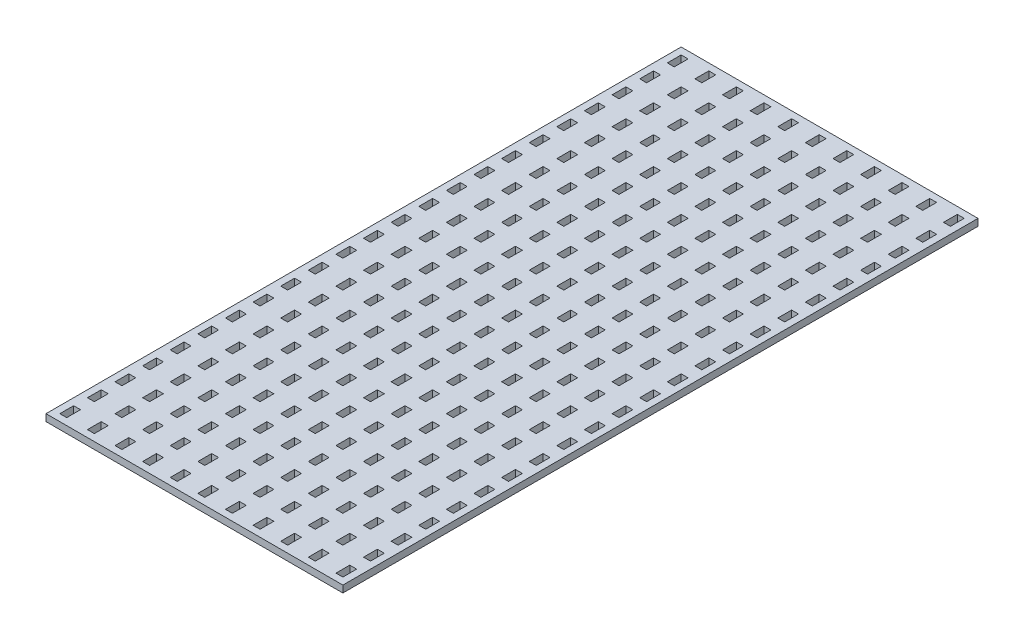
from build123d import *

# Parameters (mm, degrees)
SKETCH1_W              = 273.05
SKETCH1_H              = 584.2
BOSS_EXTRUDE1_DEPTH    = 3.175
SKETCH2_W              = 6.35
SKETCH2_H              = 12.7
CUT_EXTRUDE1_DEPTH     = 323.493113299
LPATTERN1_COUNT        = 7
LPATTERN1_PITCH        = 25.4
LPATTERN1_COUNT_DIR2   = 7
LPATTERN1_PITCH_DIR2   = 25.4
LPATTERN2_START        = -130.175
LPATTERN2_OUTLINE_W    = 6.35
LPATTERN2_OUTLINE_H    = 12.7
LPATTERN2_DEPTH        = 6.35
LPATTERN2_START_2      = -104.775
LPATTERN2_2_OUTLINE_W  = 6.35
LPATTERN2_2_OUTLINE_H  = 12.7
LPATTERN2_2_DEPTH      = 6.35
LPATTERN2_START_3      = -79.375
LPATTERN2_3_OUTLINE_W  = 6.35
LPATTERN2_3_OUTLINE_H  = 12.7
LPATTERN2_3_DEPTH      = 6.35
LPATTERN2_START_4      = -53.975
LPATTERN2_4_OUTLINE_W  = 6.35
LPATTERN2_4_OUTLINE_H  = 12.7
LPATTERN2_4_DEPTH      = 6.35
LPATTERN2_START_5      = -28.575
LPATTERN2_5_OUTLINE_W  = 6.35
LPATTERN2_5_OUTLINE_H  = 12.7
LPATTERN2_5_DEPTH      = 6.35
LPATTERN2_START_6      = -3.175
LPATTERN2_6_OUTLINE_W  = 6.35
LPATTERN2_6_OUTLINE_H  = 12.7
LPATTERN2_6_DEPTH      = 6.35
LPATTERN2_START_7      = 22.225
LPATTERN2_7_OUTLINE_W  = 6.35
LPATTERN2_7_OUTLINE_H  = 12.7
LPATTERN2_7_DEPTH      = 6.35
LPATTERN2_START_8      = 47.625
LPATTERN2_8_OUTLINE_W  = 6.35
LPATTERN2_8_OUTLINE_H  = 12.7
LPATTERN2_8_DEPTH      = 6.35
LPATTERN2_START_9      = 73.025
LPATTERN2_9_OUTLINE_W  = 6.35
LPATTERN2_9_OUTLINE_H  = 12.7
LPATTERN2_9_DEPTH      = 6.35
LPATTERN2_START_10     = 98.425
LPATTERN2_10_OUTLINE_W = 6.35
LPATTERN2_10_OUTLINE_H = 12.7
LPATTERN2_10_DEPTH     = 6.35
LPATTERN2_START_11     = 123.825
LPATTERN2_11_OUTLINE_W = 6.35
LPATTERN2_11_OUTLINE_H = 12.7
LPATTERN2_11_DEPTH     = 6.35


# Read off the part's stored shape, not the designer's step: LPattern2
with BuildPart() as part:
    # Sketch1 → Boss-Extrude1 (new, symmetric)
    with BuildSketch(Plane(origin=(0, 0, 0), x_dir=(1, 0, 0), z_dir=(0, 1, 0))):
        Rectangle(SKETCH1_W, SKETCH1_H)
    extrude(amount=BOSS_EXTRUDE1_DEPTH, both=True)

    # Sketch2 → Cut-Extrude1 (cut, through all)
    with BuildSketch(Plane(origin=(0, 3.175, 0), x_dir=(1, 0, 0), z_dir=(0, 1, 0))):
        Rectangle(SKETCH2_W, SKETCH2_H)
    cut_extrude1 = extrude(amount=-CUT_EXTRUDE1_DEPTH, mode=Mode.SUBTRACT)

    # LPattern1: Cut-Extrude1 7 × 7
    with Locations(*[Vector(1, 0, 0) * (i * LPATTERN1_PITCH) + Vector(-1, 0, 0) * (j * LPATTERN1_PITCH_DIR2) for i in range(LPATTERN1_COUNT) for j in range(LPATTERN1_COUNT_DIR2) if (i, j) != (0, 0)]):
        add(cut_extrude1, mode=Mode.SUBTRACT)

    # LPattern2 outline → LPattern2 (cut)
    with BuildSketch(Plane.YZ.offset(LPATTERN2_START)):
        with Locations((0, -25.4)):
            Rectangle(LPATTERN2_OUTLINE_W, LPATTERN2_OUTLINE_H)
        with Locations((0, 25.4)):
            Rectangle(LPATTERN2_OUTLINE_W, LPATTERN2_OUTLINE_H)
        with Locations((0, -50.8)):
            Rectangle(LPATTERN2_OUTLINE_W, LPATTERN2_OUTLINE_H)
        with Locations((0, 50.8)):
            Rectangle(LPATTERN2_OUTLINE_W, LPATTERN2_OUTLINE_H)
        with Locations((0, -76.2)):
            Rectangle(LPATTERN2_OUTLINE_W, LPATTERN2_OUTLINE_H)
        with Locations((0, 76.2)):
            Rectangle(LPATTERN2_OUTLINE_W, LPATTERN2_OUTLINE_H)
        with Locations((0, -101.6)):
            Rectangle(LPATTERN2_OUTLINE_W, LPATTERN2_OUTLINE_H)
        with Locations((0, 101.6)):
            Rectangle(LPATTERN2_OUTLINE_W, LPATTERN2_OUTLINE_H)
        with Locations((0, -127)):
            Rectangle(LPATTERN2_OUTLINE_W, LPATTERN2_OUTLINE_H)
        with Locations((0, 127)):
            Rectangle(LPATTERN2_OUTLINE_W, LPATTERN2_OUTLINE_H)
        with Locations((0, -152.4)):
            Rectangle(LPATTERN2_OUTLINE_W, LPATTERN2_OUTLINE_H)
        with Locations((0, 152.4)):
            Rectangle(LPATTERN2_OUTLINE_W, LPATTERN2_OUTLINE_H)
        with Locations((0, -177.8)):
            Rectangle(LPATTERN2_OUTLINE_W, LPATTERN2_OUTLINE_H)
        with Locations((0, 177.8)):
            Rectangle(LPATTERN2_OUTLINE_W, LPATTERN2_OUTLINE_H)
        with Locations((0, -203.2)):
            Rectangle(LPATTERN2_OUTLINE_W, LPATTERN2_OUTLINE_H)
        with Locations((0, 203.2)):
            Rectangle(LPATTERN2_OUTLINE_W, LPATTERN2_OUTLINE_H)
        with Locations((0, -228.6)):
            Rectangle(LPATTERN2_OUTLINE_W, LPATTERN2_OUTLINE_H)
        with Locations((0, 228.6)):
            Rectangle(LPATTERN2_OUTLINE_W, LPATTERN2_OUTLINE_H)
        with Locations((0, -254)):
            Rectangle(LPATTERN2_OUTLINE_W, LPATTERN2_OUTLINE_H)
        with Locations((0, 254)):
            Rectangle(LPATTERN2_OUTLINE_W, LPATTERN2_OUTLINE_H)
        with Locations((0, -279.4)):
            Rectangle(LPATTERN2_OUTLINE_W, LPATTERN2_OUTLINE_H)
        with Locations((0, 279.4)):
            Rectangle(LPATTERN2_OUTLINE_W, LPATTERN2_OUTLINE_H)
    extrude(amount=LPATTERN2_DEPTH, mode=Mode.SUBTRACT)

    # LPattern2 2 outline → LPattern2 2 (cut)
    with BuildSketch(Plane.YZ.offset(LPATTERN2_START_2)):
        with Locations((0, -25.4)):
            Rectangle(LPATTERN2_2_OUTLINE_W, LPATTERN2_2_OUTLINE_H)
        with Locations((0, 25.4)):
            Rectangle(LPATTERN2_2_OUTLINE_W, LPATTERN2_2_OUTLINE_H)
        with Locations((0, -50.8)):
            Rectangle(LPATTERN2_2_OUTLINE_W, LPATTERN2_2_OUTLINE_H)
        with Locations((0, 50.8)):
            Rectangle(LPATTERN2_2_OUTLINE_W, LPATTERN2_2_OUTLINE_H)
        with Locations((0, -76.2)):
            Rectangle(LPATTERN2_2_OUTLINE_W, LPATTERN2_2_OUTLINE_H)
        with Locations((0, 76.2)):
            Rectangle(LPATTERN2_2_OUTLINE_W, LPATTERN2_2_OUTLINE_H)
        with Locations((0, -101.6)):
            Rectangle(LPATTERN2_2_OUTLINE_W, LPATTERN2_2_OUTLINE_H)
        with Locations((0, 101.6)):
            Rectangle(LPATTERN2_2_OUTLINE_W, LPATTERN2_2_OUTLINE_H)
        with Locations((0, -127)):
            Rectangle(LPATTERN2_2_OUTLINE_W, LPATTERN2_2_OUTLINE_H)
        with Locations((0, 127)):
            Rectangle(LPATTERN2_2_OUTLINE_W, LPATTERN2_2_OUTLINE_H)
        with Locations((0, -152.4)):
            Rectangle(LPATTERN2_2_OUTLINE_W, LPATTERN2_2_OUTLINE_H)
        with Locations((0, 152.4)):
            Rectangle(LPATTERN2_2_OUTLINE_W, LPATTERN2_2_OUTLINE_H)
        with Locations((0, -177.8)):
            Rectangle(LPATTERN2_2_OUTLINE_W, LPATTERN2_2_OUTLINE_H)
        with Locations((0, 177.8)):
            Rectangle(LPATTERN2_2_OUTLINE_W, LPATTERN2_2_OUTLINE_H)
        with Locations((0, -203.2)):
            Rectangle(LPATTERN2_2_OUTLINE_W, LPATTERN2_2_OUTLINE_H)
        with Locations((0, 203.2)):
            Rectangle(LPATTERN2_2_OUTLINE_W, LPATTERN2_2_OUTLINE_H)
        with Locations((0, -228.6)):
            Rectangle(LPATTERN2_2_OUTLINE_W, LPATTERN2_2_OUTLINE_H)
        with Locations((0, 228.6)):
            Rectangle(LPATTERN2_2_OUTLINE_W, LPATTERN2_2_OUTLINE_H)
        with Locations((0, -254)):
            Rectangle(LPATTERN2_2_OUTLINE_W, LPATTERN2_2_OUTLINE_H)
        with Locations((0, 254)):
            Rectangle(LPATTERN2_2_OUTLINE_W, LPATTERN2_2_OUTLINE_H)
        with Locations((0, -279.4)):
            Rectangle(LPATTERN2_2_OUTLINE_W, LPATTERN2_2_OUTLINE_H)
        with Locations((0, 279.4)):
            Rectangle(LPATTERN2_2_OUTLINE_W, LPATTERN2_2_OUTLINE_H)
    extrude(amount=LPATTERN2_2_DEPTH, mode=Mode.SUBTRACT)

    # LPattern2 3 outline → LPattern2 3 (cut)
    with BuildSketch(Plane.YZ.offset(LPATTERN2_START_3)):
        with Locations((0, -25.4)):
            Rectangle(LPATTERN2_3_OUTLINE_W, LPATTERN2_3_OUTLINE_H)
        with Locations((0, 25.4)):
            Rectangle(LPATTERN2_3_OUTLINE_W, LPATTERN2_3_OUTLINE_H)
        with Locations((0, -50.8)):
            Rectangle(LPATTERN2_3_OUTLINE_W, LPATTERN2_3_OUTLINE_H)
        with Locations((0, 50.8)):
            Rectangle(LPATTERN2_3_OUTLINE_W, LPATTERN2_3_OUTLINE_H)
        with Locations((0, -76.2)):
            Rectangle(LPATTERN2_3_OUTLINE_W, LPATTERN2_3_OUTLINE_H)
        with Locations((0, 76.2)):
            Rectangle(LPATTERN2_3_OUTLINE_W, LPATTERN2_3_OUTLINE_H)
        with Locations((0, -101.6)):
            Rectangle(LPATTERN2_3_OUTLINE_W, LPATTERN2_3_OUTLINE_H)
        with Locations((0, 101.6)):
            Rectangle(LPATTERN2_3_OUTLINE_W, LPATTERN2_3_OUTLINE_H)
        with Locations((0, -127)):
            Rectangle(LPATTERN2_3_OUTLINE_W, LPATTERN2_3_OUTLINE_H)
        with Locations((0, 127)):
            Rectangle(LPATTERN2_3_OUTLINE_W, LPATTERN2_3_OUTLINE_H)
        with Locations((0, -152.4)):
            Rectangle(LPATTERN2_3_OUTLINE_W, LPATTERN2_3_OUTLINE_H)
        with Locations((0, 152.4)):
            Rectangle(LPATTERN2_3_OUTLINE_W, LPATTERN2_3_OUTLINE_H)
        with Locations((0, -177.8)):
            Rectangle(LPATTERN2_3_OUTLINE_W, LPATTERN2_3_OUTLINE_H)
        with Locations((0, 177.8)):
            Rectangle(LPATTERN2_3_OUTLINE_W, LPATTERN2_3_OUTLINE_H)
        with Locations((0, -203.2)):
            Rectangle(LPATTERN2_3_OUTLINE_W, LPATTERN2_3_OUTLINE_H)
        with Locations((0, 203.2)):
            Rectangle(LPATTERN2_3_OUTLINE_W, LPATTERN2_3_OUTLINE_H)
        with Locations((0, -228.6)):
            Rectangle(LPATTERN2_3_OUTLINE_W, LPATTERN2_3_OUTLINE_H)
        with Locations((0, 228.6)):
            Rectangle(LPATTERN2_3_OUTLINE_W, LPATTERN2_3_OUTLINE_H)
        with Locations((0, -254)):
            Rectangle(LPATTERN2_3_OUTLINE_W, LPATTERN2_3_OUTLINE_H)
        with Locations((0, 254)):
            Rectangle(LPATTERN2_3_OUTLINE_W, LPATTERN2_3_OUTLINE_H)
        with Locations((0, -279.4)):
            Rectangle(LPATTERN2_3_OUTLINE_W, LPATTERN2_3_OUTLINE_H)
        with Locations((0, 279.4)):
            Rectangle(LPATTERN2_3_OUTLINE_W, LPATTERN2_3_OUTLINE_H)
    extrude(amount=LPATTERN2_3_DEPTH, mode=Mode.SUBTRACT)

    # LPattern2 4 outline → LPattern2 4 (cut)
    with BuildSketch(Plane.YZ.offset(LPATTERN2_START_4)):
        with Locations((0, -25.4)):
            Rectangle(LPATTERN2_4_OUTLINE_W, LPATTERN2_4_OUTLINE_H)
        with Locations((0, 25.4)):
            Rectangle(LPATTERN2_4_OUTLINE_W, LPATTERN2_4_OUTLINE_H)
        with Locations((0, -50.8)):
            Rectangle(LPATTERN2_4_OUTLINE_W, LPATTERN2_4_OUTLINE_H)
        with Locations((0, 50.8)):
            Rectangle(LPATTERN2_4_OUTLINE_W, LPATTERN2_4_OUTLINE_H)
        with Locations((0, -76.2)):
            Rectangle(LPATTERN2_4_OUTLINE_W, LPATTERN2_4_OUTLINE_H)
        with Locations((0, 76.2)):
            Rectangle(LPATTERN2_4_OUTLINE_W, LPATTERN2_4_OUTLINE_H)
        with Locations((0, -101.6)):
            Rectangle(LPATTERN2_4_OUTLINE_W, LPATTERN2_4_OUTLINE_H)
        with Locations((0, 101.6)):
            Rectangle(LPATTERN2_4_OUTLINE_W, LPATTERN2_4_OUTLINE_H)
        with Locations((0, -127)):
            Rectangle(LPATTERN2_4_OUTLINE_W, LPATTERN2_4_OUTLINE_H)
        with Locations((0, 127)):
            Rectangle(LPATTERN2_4_OUTLINE_W, LPATTERN2_4_OUTLINE_H)
        with Locations((0, -152.4)):
            Rectangle(LPATTERN2_4_OUTLINE_W, LPATTERN2_4_OUTLINE_H)
        with Locations((0, 152.4)):
            Rectangle(LPATTERN2_4_OUTLINE_W, LPATTERN2_4_OUTLINE_H)
        with Locations((0, -177.8)):
            Rectangle(LPATTERN2_4_OUTLINE_W, LPATTERN2_4_OUTLINE_H)
        with Locations((0, 177.8)):
            Rectangle(LPATTERN2_4_OUTLINE_W, LPATTERN2_4_OUTLINE_H)
        with Locations((0, -203.2)):
            Rectangle(LPATTERN2_4_OUTLINE_W, LPATTERN2_4_OUTLINE_H)
        with Locations((0, 203.2)):
            Rectangle(LPATTERN2_4_OUTLINE_W, LPATTERN2_4_OUTLINE_H)
        with Locations((0, -228.6)):
            Rectangle(LPATTERN2_4_OUTLINE_W, LPATTERN2_4_OUTLINE_H)
        with Locations((0, 228.6)):
            Rectangle(LPATTERN2_4_OUTLINE_W, LPATTERN2_4_OUTLINE_H)
        with Locations((0, -254)):
            Rectangle(LPATTERN2_4_OUTLINE_W, LPATTERN2_4_OUTLINE_H)
        with Locations((0, 254)):
            Rectangle(LPATTERN2_4_OUTLINE_W, LPATTERN2_4_OUTLINE_H)
        with Locations((0, -279.4)):
            Rectangle(LPATTERN2_4_OUTLINE_W, LPATTERN2_4_OUTLINE_H)
        with Locations((0, 279.4)):
            Rectangle(LPATTERN2_4_OUTLINE_W, LPATTERN2_4_OUTLINE_H)
    extrude(amount=LPATTERN2_4_DEPTH, mode=Mode.SUBTRACT)

    # LPattern2 5 outline → LPattern2 5 (cut)
    with BuildSketch(Plane.YZ.offset(LPATTERN2_START_5)):
        with Locations((0, -25.4)):
            Rectangle(LPATTERN2_5_OUTLINE_W, LPATTERN2_5_OUTLINE_H)
        with Locations((0, 25.4)):
            Rectangle(LPATTERN2_5_OUTLINE_W, LPATTERN2_5_OUTLINE_H)
        with Locations((0, -50.8)):
            Rectangle(LPATTERN2_5_OUTLINE_W, LPATTERN2_5_OUTLINE_H)
        with Locations((0, 50.8)):
            Rectangle(LPATTERN2_5_OUTLINE_W, LPATTERN2_5_OUTLINE_H)
        with Locations((0, -76.2)):
            Rectangle(LPATTERN2_5_OUTLINE_W, LPATTERN2_5_OUTLINE_H)
        with Locations((0, 76.2)):
            Rectangle(LPATTERN2_5_OUTLINE_W, LPATTERN2_5_OUTLINE_H)
        with Locations((0, -101.6)):
            Rectangle(LPATTERN2_5_OUTLINE_W, LPATTERN2_5_OUTLINE_H)
        with Locations((0, 101.6)):
            Rectangle(LPATTERN2_5_OUTLINE_W, LPATTERN2_5_OUTLINE_H)
        with Locations((0, -127)):
            Rectangle(LPATTERN2_5_OUTLINE_W, LPATTERN2_5_OUTLINE_H)
        with Locations((0, 127)):
            Rectangle(LPATTERN2_5_OUTLINE_W, LPATTERN2_5_OUTLINE_H)
        with Locations((0, -152.4)):
            Rectangle(LPATTERN2_5_OUTLINE_W, LPATTERN2_5_OUTLINE_H)
        with Locations((0, 152.4)):
            Rectangle(LPATTERN2_5_OUTLINE_W, LPATTERN2_5_OUTLINE_H)
        with Locations((0, -177.8)):
            Rectangle(LPATTERN2_5_OUTLINE_W, LPATTERN2_5_OUTLINE_H)
        with Locations((0, 177.8)):
            Rectangle(LPATTERN2_5_OUTLINE_W, LPATTERN2_5_OUTLINE_H)
        with Locations((0, -203.2)):
            Rectangle(LPATTERN2_5_OUTLINE_W, LPATTERN2_5_OUTLINE_H)
        with Locations((0, 203.2)):
            Rectangle(LPATTERN2_5_OUTLINE_W, LPATTERN2_5_OUTLINE_H)
        with Locations((0, -228.6)):
            Rectangle(LPATTERN2_5_OUTLINE_W, LPATTERN2_5_OUTLINE_H)
        with Locations((0, 228.6)):
            Rectangle(LPATTERN2_5_OUTLINE_W, LPATTERN2_5_OUTLINE_H)
        with Locations((0, -254)):
            Rectangle(LPATTERN2_5_OUTLINE_W, LPATTERN2_5_OUTLINE_H)
        with Locations((0, 254)):
            Rectangle(LPATTERN2_5_OUTLINE_W, LPATTERN2_5_OUTLINE_H)
        with Locations((0, -279.4)):
            Rectangle(LPATTERN2_5_OUTLINE_W, LPATTERN2_5_OUTLINE_H)
        with Locations((0, 279.4)):
            Rectangle(LPATTERN2_5_OUTLINE_W, LPATTERN2_5_OUTLINE_H)
    extrude(amount=LPATTERN2_5_DEPTH, mode=Mode.SUBTRACT)

    # LPattern2 6 outline → LPattern2 6 (cut)
    with BuildSketch(Plane.YZ.offset(LPATTERN2_START_6)):
        with Locations((0, -25.4)):
            Rectangle(LPATTERN2_6_OUTLINE_W, LPATTERN2_6_OUTLINE_H)
        with Locations((0, 25.4)):
            Rectangle(LPATTERN2_6_OUTLINE_W, LPATTERN2_6_OUTLINE_H)
        with Locations((0, -50.8)):
            Rectangle(LPATTERN2_6_OUTLINE_W, LPATTERN2_6_OUTLINE_H)
        with Locations((0, 50.8)):
            Rectangle(LPATTERN2_6_OUTLINE_W, LPATTERN2_6_OUTLINE_H)
        with Locations((0, -76.2)):
            Rectangle(LPATTERN2_6_OUTLINE_W, LPATTERN2_6_OUTLINE_H)
        with Locations((0, 76.2)):
            Rectangle(LPATTERN2_6_OUTLINE_W, LPATTERN2_6_OUTLINE_H)
        with Locations((0, -101.6)):
            Rectangle(LPATTERN2_6_OUTLINE_W, LPATTERN2_6_OUTLINE_H)
        with Locations((0, 101.6)):
            Rectangle(LPATTERN2_6_OUTLINE_W, LPATTERN2_6_OUTLINE_H)
        with Locations((0, -127)):
            Rectangle(LPATTERN2_6_OUTLINE_W, LPATTERN2_6_OUTLINE_H)
        with Locations((0, 127)):
            Rectangle(LPATTERN2_6_OUTLINE_W, LPATTERN2_6_OUTLINE_H)
        with Locations((0, -152.4)):
            Rectangle(LPATTERN2_6_OUTLINE_W, LPATTERN2_6_OUTLINE_H)
        with Locations((0, 152.4)):
            Rectangle(LPATTERN2_6_OUTLINE_W, LPATTERN2_6_OUTLINE_H)
        with Locations((0, -177.8)):
            Rectangle(LPATTERN2_6_OUTLINE_W, LPATTERN2_6_OUTLINE_H)
        with Locations((0, 177.8)):
            Rectangle(LPATTERN2_6_OUTLINE_W, LPATTERN2_6_OUTLINE_H)
        with Locations((0, -203.2)):
            Rectangle(LPATTERN2_6_OUTLINE_W, LPATTERN2_6_OUTLINE_H)
        with Locations((0, 203.2)):
            Rectangle(LPATTERN2_6_OUTLINE_W, LPATTERN2_6_OUTLINE_H)
        with Locations((0, -228.6)):
            Rectangle(LPATTERN2_6_OUTLINE_W, LPATTERN2_6_OUTLINE_H)
        with Locations((0, 228.6)):
            Rectangle(LPATTERN2_6_OUTLINE_W, LPATTERN2_6_OUTLINE_H)
        with Locations((0, -254)):
            Rectangle(LPATTERN2_6_OUTLINE_W, LPATTERN2_6_OUTLINE_H)
        with Locations((0, 254)):
            Rectangle(LPATTERN2_6_OUTLINE_W, LPATTERN2_6_OUTLINE_H)
        with Locations((0, -279.4)):
            Rectangle(LPATTERN2_6_OUTLINE_W, LPATTERN2_6_OUTLINE_H)
        with Locations((0, 279.4)):
            Rectangle(LPATTERN2_6_OUTLINE_W, LPATTERN2_6_OUTLINE_H)
    extrude(amount=LPATTERN2_6_DEPTH, mode=Mode.SUBTRACT)

    # LPattern2 7 outline → LPattern2 7 (cut)
    with BuildSketch(Plane.YZ.offset(LPATTERN2_START_7)):
        with Locations((0, -25.4)):
            Rectangle(LPATTERN2_7_OUTLINE_W, LPATTERN2_7_OUTLINE_H)
        with Locations((0, 25.4)):
            Rectangle(LPATTERN2_7_OUTLINE_W, LPATTERN2_7_OUTLINE_H)
        with Locations((0, -50.8)):
            Rectangle(LPATTERN2_7_OUTLINE_W, LPATTERN2_7_OUTLINE_H)
        with Locations((0, 50.8)):
            Rectangle(LPATTERN2_7_OUTLINE_W, LPATTERN2_7_OUTLINE_H)
        with Locations((0, -76.2)):
            Rectangle(LPATTERN2_7_OUTLINE_W, LPATTERN2_7_OUTLINE_H)
        with Locations((0, 76.2)):
            Rectangle(LPATTERN2_7_OUTLINE_W, LPATTERN2_7_OUTLINE_H)
        with Locations((0, -101.6)):
            Rectangle(LPATTERN2_7_OUTLINE_W, LPATTERN2_7_OUTLINE_H)
        with Locations((0, 101.6)):
            Rectangle(LPATTERN2_7_OUTLINE_W, LPATTERN2_7_OUTLINE_H)
        with Locations((0, -127)):
            Rectangle(LPATTERN2_7_OUTLINE_W, LPATTERN2_7_OUTLINE_H)
        with Locations((0, 127)):
            Rectangle(LPATTERN2_7_OUTLINE_W, LPATTERN2_7_OUTLINE_H)
        with Locations((0, -152.4)):
            Rectangle(LPATTERN2_7_OUTLINE_W, LPATTERN2_7_OUTLINE_H)
        with Locations((0, 152.4)):
            Rectangle(LPATTERN2_7_OUTLINE_W, LPATTERN2_7_OUTLINE_H)
        with Locations((0, -177.8)):
            Rectangle(LPATTERN2_7_OUTLINE_W, LPATTERN2_7_OUTLINE_H)
        with Locations((0, 177.8)):
            Rectangle(LPATTERN2_7_OUTLINE_W, LPATTERN2_7_OUTLINE_H)
        with Locations((0, -203.2)):
            Rectangle(LPATTERN2_7_OUTLINE_W, LPATTERN2_7_OUTLINE_H)
        with Locations((0, 203.2)):
            Rectangle(LPATTERN2_7_OUTLINE_W, LPATTERN2_7_OUTLINE_H)
        with Locations((0, -228.6)):
            Rectangle(LPATTERN2_7_OUTLINE_W, LPATTERN2_7_OUTLINE_H)
        with Locations((0, 228.6)):
            Rectangle(LPATTERN2_7_OUTLINE_W, LPATTERN2_7_OUTLINE_H)
        with Locations((0, -254)):
            Rectangle(LPATTERN2_7_OUTLINE_W, LPATTERN2_7_OUTLINE_H)
        with Locations((0, 254)):
            Rectangle(LPATTERN2_7_OUTLINE_W, LPATTERN2_7_OUTLINE_H)
        with Locations((0, -279.4)):
            Rectangle(LPATTERN2_7_OUTLINE_W, LPATTERN2_7_OUTLINE_H)
        with Locations((0, 279.4)):
            Rectangle(LPATTERN2_7_OUTLINE_W, LPATTERN2_7_OUTLINE_H)
    extrude(amount=LPATTERN2_7_DEPTH, mode=Mode.SUBTRACT)

    # LPattern2 8 outline → LPattern2 8 (cut)
    with BuildSketch(Plane.YZ.offset(LPATTERN2_START_8)):
        with Locations((0, -25.4)):
            Rectangle(LPATTERN2_8_OUTLINE_W, LPATTERN2_8_OUTLINE_H)
        with Locations((0, 25.4)):
            Rectangle(LPATTERN2_8_OUTLINE_W, LPATTERN2_8_OUTLINE_H)
        with Locations((0, -50.8)):
            Rectangle(LPATTERN2_8_OUTLINE_W, LPATTERN2_8_OUTLINE_H)
        with Locations((0, 50.8)):
            Rectangle(LPATTERN2_8_OUTLINE_W, LPATTERN2_8_OUTLINE_H)
        with Locations((0, -76.2)):
            Rectangle(LPATTERN2_8_OUTLINE_W, LPATTERN2_8_OUTLINE_H)
        with Locations((0, 76.2)):
            Rectangle(LPATTERN2_8_OUTLINE_W, LPATTERN2_8_OUTLINE_H)
        with Locations((0, -101.6)):
            Rectangle(LPATTERN2_8_OUTLINE_W, LPATTERN2_8_OUTLINE_H)
        with Locations((0, 101.6)):
            Rectangle(LPATTERN2_8_OUTLINE_W, LPATTERN2_8_OUTLINE_H)
        with Locations((0, -127)):
            Rectangle(LPATTERN2_8_OUTLINE_W, LPATTERN2_8_OUTLINE_H)
        with Locations((0, 127)):
            Rectangle(LPATTERN2_8_OUTLINE_W, LPATTERN2_8_OUTLINE_H)
        with Locations((0, -152.4)):
            Rectangle(LPATTERN2_8_OUTLINE_W, LPATTERN2_8_OUTLINE_H)
        with Locations((0, 152.4)):
            Rectangle(LPATTERN2_8_OUTLINE_W, LPATTERN2_8_OUTLINE_H)
        with Locations((0, -177.8)):
            Rectangle(LPATTERN2_8_OUTLINE_W, LPATTERN2_8_OUTLINE_H)
        with Locations((0, 177.8)):
            Rectangle(LPATTERN2_8_OUTLINE_W, LPATTERN2_8_OUTLINE_H)
        with Locations((0, -203.2)):
            Rectangle(LPATTERN2_8_OUTLINE_W, LPATTERN2_8_OUTLINE_H)
        with Locations((0, 203.2)):
            Rectangle(LPATTERN2_8_OUTLINE_W, LPATTERN2_8_OUTLINE_H)
        with Locations((0, -228.6)):
            Rectangle(LPATTERN2_8_OUTLINE_W, LPATTERN2_8_OUTLINE_H)
        with Locations((0, 228.6)):
            Rectangle(LPATTERN2_8_OUTLINE_W, LPATTERN2_8_OUTLINE_H)
        with Locations((0, -254)):
            Rectangle(LPATTERN2_8_OUTLINE_W, LPATTERN2_8_OUTLINE_H)
        with Locations((0, 254)):
            Rectangle(LPATTERN2_8_OUTLINE_W, LPATTERN2_8_OUTLINE_H)
        with Locations((0, -279.4)):
            Rectangle(LPATTERN2_8_OUTLINE_W, LPATTERN2_8_OUTLINE_H)
        with Locations((0, 279.4)):
            Rectangle(LPATTERN2_8_OUTLINE_W, LPATTERN2_8_OUTLINE_H)
    extrude(amount=LPATTERN2_8_DEPTH, mode=Mode.SUBTRACT)

    # LPattern2 9 outline → LPattern2 9 (cut)
    with BuildSketch(Plane.YZ.offset(LPATTERN2_START_9)):
        with Locations((0, -25.4)):
            Rectangle(LPATTERN2_9_OUTLINE_W, LPATTERN2_9_OUTLINE_H)
        with Locations((0, 25.4)):
            Rectangle(LPATTERN2_9_OUTLINE_W, LPATTERN2_9_OUTLINE_H)
        with Locations((0, -50.8)):
            Rectangle(LPATTERN2_9_OUTLINE_W, LPATTERN2_9_OUTLINE_H)
        with Locations((0, 50.8)):
            Rectangle(LPATTERN2_9_OUTLINE_W, LPATTERN2_9_OUTLINE_H)
        with Locations((0, -76.2)):
            Rectangle(LPATTERN2_9_OUTLINE_W, LPATTERN2_9_OUTLINE_H)
        with Locations((0, 76.2)):
            Rectangle(LPATTERN2_9_OUTLINE_W, LPATTERN2_9_OUTLINE_H)
        with Locations((0, -101.6)):
            Rectangle(LPATTERN2_9_OUTLINE_W, LPATTERN2_9_OUTLINE_H)
        with Locations((0, 101.6)):
            Rectangle(LPATTERN2_9_OUTLINE_W, LPATTERN2_9_OUTLINE_H)
        with Locations((0, -127)):
            Rectangle(LPATTERN2_9_OUTLINE_W, LPATTERN2_9_OUTLINE_H)
        with Locations((0, 127)):
            Rectangle(LPATTERN2_9_OUTLINE_W, LPATTERN2_9_OUTLINE_H)
        with Locations((0, -152.4)):
            Rectangle(LPATTERN2_9_OUTLINE_W, LPATTERN2_9_OUTLINE_H)
        with Locations((0, 152.4)):
            Rectangle(LPATTERN2_9_OUTLINE_W, LPATTERN2_9_OUTLINE_H)
        with Locations((0, -177.8)):
            Rectangle(LPATTERN2_9_OUTLINE_W, LPATTERN2_9_OUTLINE_H)
        with Locations((0, 177.8)):
            Rectangle(LPATTERN2_9_OUTLINE_W, LPATTERN2_9_OUTLINE_H)
        with Locations((0, -203.2)):
            Rectangle(LPATTERN2_9_OUTLINE_W, LPATTERN2_9_OUTLINE_H)
        with Locations((0, 203.2)):
            Rectangle(LPATTERN2_9_OUTLINE_W, LPATTERN2_9_OUTLINE_H)
        with Locations((0, -228.6)):
            Rectangle(LPATTERN2_9_OUTLINE_W, LPATTERN2_9_OUTLINE_H)
        with Locations((0, 228.6)):
            Rectangle(LPATTERN2_9_OUTLINE_W, LPATTERN2_9_OUTLINE_H)
        with Locations((0, -254)):
            Rectangle(LPATTERN2_9_OUTLINE_W, LPATTERN2_9_OUTLINE_H)
        with Locations((0, 254)):
            Rectangle(LPATTERN2_9_OUTLINE_W, LPATTERN2_9_OUTLINE_H)
        with Locations((0, -279.4)):
            Rectangle(LPATTERN2_9_OUTLINE_W, LPATTERN2_9_OUTLINE_H)
        with Locations((0, 279.4)):
            Rectangle(LPATTERN2_9_OUTLINE_W, LPATTERN2_9_OUTLINE_H)
    extrude(amount=LPATTERN2_9_DEPTH, mode=Mode.SUBTRACT)

    # LPattern2 10 outline → LPattern2 10 (cut)
    with BuildSketch(Plane.YZ.offset(LPATTERN2_START_10)):
        with Locations((0, -25.4)):
            Rectangle(LPATTERN2_10_OUTLINE_W, LPATTERN2_10_OUTLINE_H)
        with Locations((0, 25.4)):
            Rectangle(LPATTERN2_10_OUTLINE_W, LPATTERN2_10_OUTLINE_H)
        with Locations((0, -50.8)):
            Rectangle(LPATTERN2_10_OUTLINE_W, LPATTERN2_10_OUTLINE_H)
        with Locations((0, 50.8)):
            Rectangle(LPATTERN2_10_OUTLINE_W, LPATTERN2_10_OUTLINE_H)
        with Locations((0, -76.2)):
            Rectangle(LPATTERN2_10_OUTLINE_W, LPATTERN2_10_OUTLINE_H)
        with Locations((0, 76.2)):
            Rectangle(LPATTERN2_10_OUTLINE_W, LPATTERN2_10_OUTLINE_H)
        with Locations((0, -101.6)):
            Rectangle(LPATTERN2_10_OUTLINE_W, LPATTERN2_10_OUTLINE_H)
        with Locations((0, 101.6)):
            Rectangle(LPATTERN2_10_OUTLINE_W, LPATTERN2_10_OUTLINE_H)
        with Locations((0, -127)):
            Rectangle(LPATTERN2_10_OUTLINE_W, LPATTERN2_10_OUTLINE_H)
        with Locations((0, 127)):
            Rectangle(LPATTERN2_10_OUTLINE_W, LPATTERN2_10_OUTLINE_H)
        with Locations((0, -152.4)):
            Rectangle(LPATTERN2_10_OUTLINE_W, LPATTERN2_10_OUTLINE_H)
        with Locations((0, 152.4)):
            Rectangle(LPATTERN2_10_OUTLINE_W, LPATTERN2_10_OUTLINE_H)
        with Locations((0, -177.8)):
            Rectangle(LPATTERN2_10_OUTLINE_W, LPATTERN2_10_OUTLINE_H)
        with Locations((0, 177.8)):
            Rectangle(LPATTERN2_10_OUTLINE_W, LPATTERN2_10_OUTLINE_H)
        with Locations((0, -203.2)):
            Rectangle(LPATTERN2_10_OUTLINE_W, LPATTERN2_10_OUTLINE_H)
        with Locations((0, 203.2)):
            Rectangle(LPATTERN2_10_OUTLINE_W, LPATTERN2_10_OUTLINE_H)
        with Locations((0, -228.6)):
            Rectangle(LPATTERN2_10_OUTLINE_W, LPATTERN2_10_OUTLINE_H)
        with Locations((0, 228.6)):
            Rectangle(LPATTERN2_10_OUTLINE_W, LPATTERN2_10_OUTLINE_H)
        with Locations((0, -254)):
            Rectangle(LPATTERN2_10_OUTLINE_W, LPATTERN2_10_OUTLINE_H)
        with Locations((0, 254)):
            Rectangle(LPATTERN2_10_OUTLINE_W, LPATTERN2_10_OUTLINE_H)
        with Locations((0, -279.4)):
            Rectangle(LPATTERN2_10_OUTLINE_W, LPATTERN2_10_OUTLINE_H)
        with Locations((0, 279.4)):
            Rectangle(LPATTERN2_10_OUTLINE_W, LPATTERN2_10_OUTLINE_H)
    extrude(amount=LPATTERN2_10_DEPTH, mode=Mode.SUBTRACT)

    # LPattern2 11 outline → LPattern2 11 (cut)
    with BuildSketch(Plane.YZ.offset(LPATTERN2_START_11)):
        with Locations((0, -25.4)):
            Rectangle(LPATTERN2_11_OUTLINE_W, LPATTERN2_11_OUTLINE_H)
        with Locations((0, 25.4)):
            Rectangle(LPATTERN2_11_OUTLINE_W, LPATTERN2_11_OUTLINE_H)
        with Locations((0, -50.8)):
            Rectangle(LPATTERN2_11_OUTLINE_W, LPATTERN2_11_OUTLINE_H)
        with Locations((0, 50.8)):
            Rectangle(LPATTERN2_11_OUTLINE_W, LPATTERN2_11_OUTLINE_H)
        with Locations((0, -76.2)):
            Rectangle(LPATTERN2_11_OUTLINE_W, LPATTERN2_11_OUTLINE_H)
        with Locations((0, 76.2)):
            Rectangle(LPATTERN2_11_OUTLINE_W, LPATTERN2_11_OUTLINE_H)
        with Locations((0, -101.6)):
            Rectangle(LPATTERN2_11_OUTLINE_W, LPATTERN2_11_OUTLINE_H)
        with Locations((0, 101.6)):
            Rectangle(LPATTERN2_11_OUTLINE_W, LPATTERN2_11_OUTLINE_H)
        with Locations((0, -127)):
            Rectangle(LPATTERN2_11_OUTLINE_W, LPATTERN2_11_OUTLINE_H)
        with Locations((0, 127)):
            Rectangle(LPATTERN2_11_OUTLINE_W, LPATTERN2_11_OUTLINE_H)
        with Locations((0, -152.4)):
            Rectangle(LPATTERN2_11_OUTLINE_W, LPATTERN2_11_OUTLINE_H)
        with Locations((0, 152.4)):
            Rectangle(LPATTERN2_11_OUTLINE_W, LPATTERN2_11_OUTLINE_H)
        with Locations((0, -177.8)):
            Rectangle(LPATTERN2_11_OUTLINE_W, LPATTERN2_11_OUTLINE_H)
        with Locations((0, 177.8)):
            Rectangle(LPATTERN2_11_OUTLINE_W, LPATTERN2_11_OUTLINE_H)
        with Locations((0, -203.2)):
            Rectangle(LPATTERN2_11_OUTLINE_W, LPATTERN2_11_OUTLINE_H)
        with Locations((0, 203.2)):
            Rectangle(LPATTERN2_11_OUTLINE_W, LPATTERN2_11_OUTLINE_H)
        with Locations((0, -228.6)):
            Rectangle(LPATTERN2_11_OUTLINE_W, LPATTERN2_11_OUTLINE_H)
        with Locations((0, 228.6)):
            Rectangle(LPATTERN2_11_OUTLINE_W, LPATTERN2_11_OUTLINE_H)
        with Locations((0, -254)):
            Rectangle(LPATTERN2_11_OUTLINE_W, LPATTERN2_11_OUTLINE_H)
        with Locations((0, 254)):
            Rectangle(LPATTERN2_11_OUTLINE_W, LPATTERN2_11_OUTLINE_H)
        with Locations((0, -279.4)):
            Rectangle(LPATTERN2_11_OUTLINE_W, LPATTERN2_11_OUTLINE_H)
        with Locations((0, 279.4)):
            Rectangle(LPATTERN2_11_OUTLINE_W, LPATTERN2_11_OUTLINE_H)
    extrude(amount=LPATTERN2_11_DEPTH, mode=Mode.SUBTRACT)


solid = part.part
